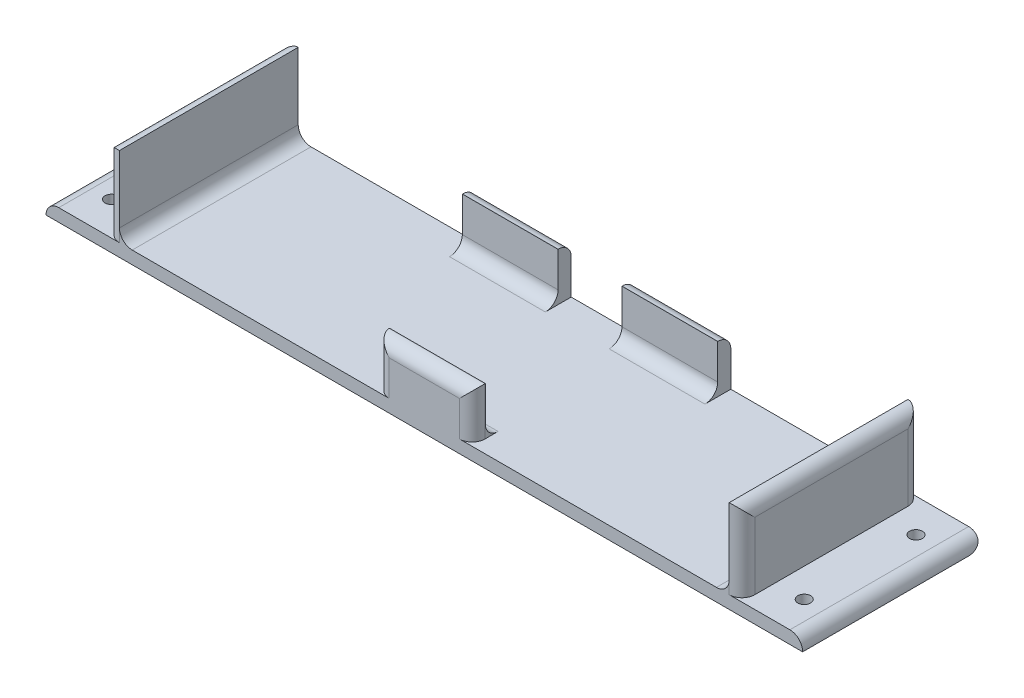
from build123d import *

# Parameters (mm, degrees)
SKETCH1_W           = 237
SKETCH1_H           = 56
BOSS_EXTRUDE1_DEPTH = 4
SKETCH2_R           = 2
CUT_EXTRUDE1_DEPTH  = 5
SKETCH5_W           = 30
SKETCH5_H           = 4.1
BOSS_EXTRUDE2_DEPTH = 15
SKETCH6_W           = 4
SKETCH6_H           = 56
BOSS_EXTRUDE3_DEPTH = 25
FILLET1_START       = -119
FILLET1_DEPTH       = 238
FILLET3_R           = 4
FILLET4_R           = 4
FILLET5_R           = 4
FILLET6_R           = 4


with BuildPart() as part:
    # Sketch1 → Boss-Extrude1 (new body)
    with BuildSketch(Plane(origin=(0, 0, 0), x_dir=(1, 0, 0), z_dir=(0, 1, 0))):
        Rectangle(SKETCH1_W, SKETCH1_H)
    extrude(amount=BOSS_EXTRUDE1_DEPTH)

    # Sketch2 → Cut-Extrude1 (cut)
    with BuildSketch(Plane.XZ):
        with Locations(Location((108.5, 17.5, 0), (0, 0, 270))):
            Circle(SKETCH2_R)
        with Locations(Location((108.5, -17.5, 0), (0, 0, 270))):
            Circle(SKETCH2_R)
        with Locations(Location((-108.5, -17.5, 0), (0, 0, 270))):
            Circle(SKETCH2_R)
        with Locations(Location((-108.5, 17.5, 0), (0, 0, 270))):
            Circle(SKETCH2_R)
    extrude(amount=-CUT_EXTRUDE1_DEPTH, mode=Mode.SUBTRACT)

    # Sketch5 → Boss-Extrude2 (add)
    with BuildSketch(Plane(origin=(0, 4, 0), x_dir=(1, 0, 0), z_dir=(0, 1, 0))):
        with Locations((0, -25.95)):
            Rectangle(SKETCH5_W, SKETCH5_H)
        with Locations((25, 25.95)):
            Rectangle(SKETCH5_W, SKETCH5_H)
        with Locations((-25, 25.95)):
            Rectangle(SKETCH5_W, SKETCH5_H)
    extrude(amount=BOSS_EXTRUDE2_DEPTH)

    # Sketch6 → Boss-Extrude3 (add)
    with BuildSketch(Plane(origin=(0, 4, 0), x_dir=(1, 0, 0), z_dir=(0, 1, 0))):
        with Locations((-97.5, 0)):
            Rectangle(SKETCH6_W, SKETCH6_H)
        with Locations((97.5, 0)):
            Rectangle(SKETCH6_W, SKETCH6_H)
    extrude(amount=BOSS_EXTRUDE3_DEPTH)

    # Fillet1: read off the stored shape, not the designer's step
    # Fillet1 outline → Fillet1 (cut)
    with BuildSketch(Plane.YZ.offset(FILLET1_START)):
        with BuildLine():
            ThreePointArc((4, -28), (1.171572875, -26.828427125), (0, -24))
            Line((0, -24), (0, -28))
            Line((0, -28), (4, -28))
        make_face()
    extrude(amount=FILLET1_DEPTH, mode=Mode.SUBTRACT)

    # Fillet3
    fillet3_edges = [part.edges().sort_by_distance(p)[0] for p in [
        (0, 4, 23.9),
        (25, 4, -23.9),
        (-25, 4, -23.9),
        (-95.5, 4, 0),
        (95.5, 4, 0),
    ]]
    fillet(fillet3_edges, radius=FILLET3_R)

    # Fillet4
    # the kernel refuses this fillet: 4 mm, written as the material it takes off along each edge
    with BuildSketch(Plane(origin=(-118.5, 4, -38), x_dir=(0, -1, 0), z_dir=(0, 0, 1)), Plane(origin=(-99.5, 29, -38), x_dir=(0, -1, 0), z_dir=(0, 0, 1))) as fillet4_piece_1:
        with BuildLine():
            CenterArc((FILLET4_R, FILLET4_R), FILLET4_R, 180, 90)
            Line((0, FILLET4_R), (0, 0))
            Line((0, 0), (FILLET4_R, 0))
        make_face()
    extrude(amount=76, mode=Mode.SUBTRACT)
    with BuildSketch(Plane(origin=(118.5, 4, 38), x_dir=(-1, 0, 0), z_dir=(0, 0, -1)), Plane(origin=(99.5, 29, 38), x_dir=(-1, 0, 0), z_dir=(0, 0, -1))) as fillet4_piece_2:
        with BuildLine():
            CenterArc((FILLET4_R, -FILLET4_R), FILLET4_R, 90, 90)
            Line((0, -FILLET4_R), (0, 0))
            Line((0, 0), (FILLET4_R, 0))
        make_face()
    extrude(amount=76, mode=Mode.SUBTRACT)
    with BuildSketch(Plane(origin=(-99.5, 4, -28), x_dir=(1, 0, 0), z_dir=(0, 1, 0)), Plane(origin=(99.5, 4, 28), x_dir=(-1, 0, 0), z_dir=(0, 1, 0))) as fillet4_piece_3:
        with BuildLine():
            CenterArc((FILLET4_R, -FILLET4_R), FILLET4_R, 90, 90)
            Line((0, -FILLET4_R), (0, 0))
            Line((0, 0), (FILLET4_R, 0))
        make_face()
    extrude(amount=35, mode=Mode.SUBTRACT)
    with BuildSketch(Plane(origin=(-99.5, 4, 28), x_dir=(1, 0, 0), z_dir=(0, 1, 0)), Plane(origin=(99.5, 4, -28), x_dir=(-1, 0, 0), z_dir=(0, 1, 0))) as fillet4_piece_4:
        with BuildLine():
            CenterArc((FILLET4_R, FILLET4_R), FILLET4_R, 180, 90)
            Line((0, FILLET4_R), (0, 0))
            Line((0, 0), (FILLET4_R, 0))
        make_face()
    extrude(amount=35, mode=Mode.SUBTRACT)

    # Fillet5
    fillet5_edges = [part.edges().sort_by_distance(p)[0] for p in [
        (15, 11.5, 28),
        (-15, 11.5, 28),
        (0, 19, 28),
    ]]
    fillet(fillet5_edges, radius=FILLET5_R)

    # Fillet6
    fillet6_edges = [part.edges().sort_by_distance(p)[0] for p in [
        (25, 19, -28),
        (-25, 19, -28),
    ]]
    fillet(fillet6_edges, radius=FILLET6_R)


solid = part.part
